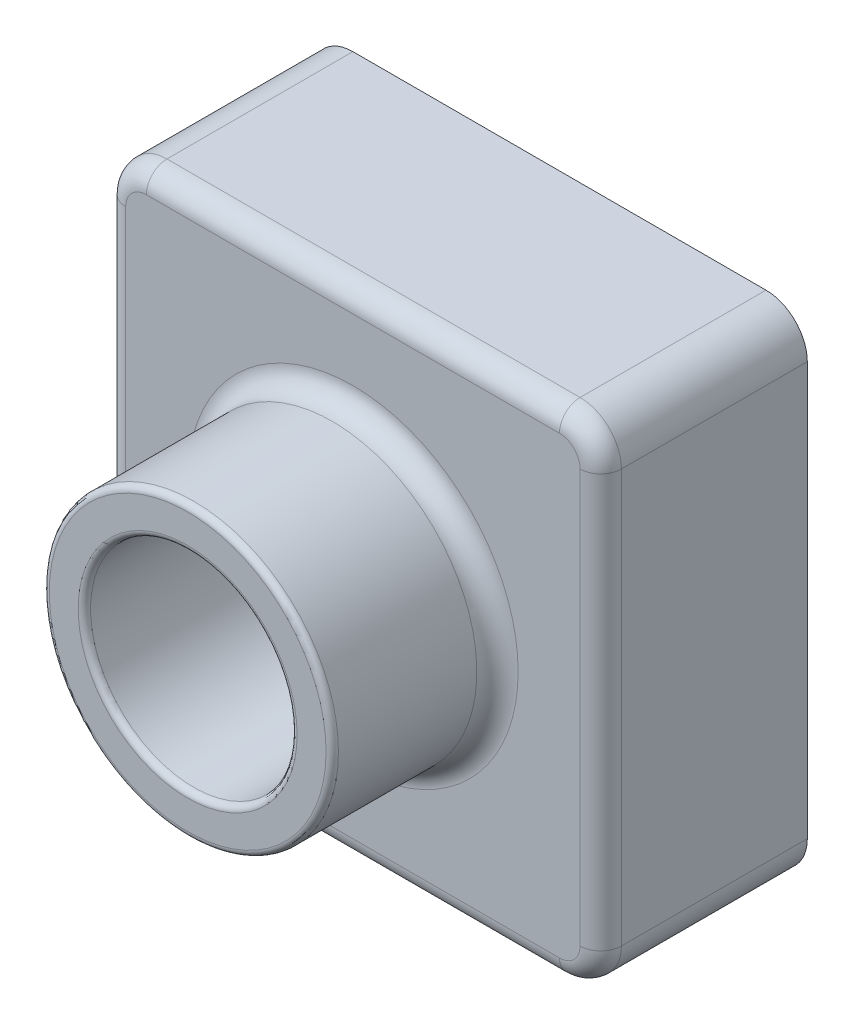
from build123d import *

# Parameters (mm, degrees)
SKETCH1_W           = 120
SKETCH1_H           = 120
BOSS_EXTRUDE1_DEPTH = 50
SKETCH3_R           = 35
BOSS_EXTRUDE2_DEPTH = 40
SKETCH4_R           = 25
CUT_EXTRUDE1_DEPTH  = 193.093727123
FILLET1_R           = 10
FILLET2_R           = 1.5
FILLET5_R           = 5
SHELL1_T            = -2


with BuildPart() as part:
    # Sketch1 → Boss-Extrude1 (new body)
    with BuildSketch(Plane.XY):
        with Locations((60, 60)):
            Rectangle(SKETCH1_W, SKETCH1_H)
    extrude(amount=BOSS_EXTRUDE1_DEPTH)

    # Sketch3 → Boss-Extrude2 (add)
    with BuildSketch(Plane.XY.offset(50)):
        with Locations((60, 60)):
            Circle(SKETCH3_R)
    extrude(amount=BOSS_EXTRUDE2_DEPTH)

    # Sketch4 → Cut-Extrude1 (cut, through all)
    with BuildSketch(Plane.XY.offset(90)):
        with Locations((60, 60)):
            Circle(SKETCH4_R)
    extrude(amount=-CUT_EXTRUDE1_DEPTH, mode=Mode.SUBTRACT)

    # Fillet1
    fillet1_edges = [part.edges().sort_by_distance(p)[0] for p in [
        (0, 0, 25),
        (0, 120, 25),
        (120, 0, 25),
        (120, 120, 25),
    ]]
    fillet(fillet1_edges, radius=FILLET1_R)

    # Fillet2
    fillet2_edges = [part.edges().sort_by_distance(p)[0] for p in [
        (25, 60, 90),
        (35, 60, 90),
    ]]
    fillet(fillet2_edges, radius=FILLET2_R)

    # Fillet5
    fillet5_edges = [part.edges().sort_by_distance(p)[0] for p in [
        (117.071067812, 2.928932188, 50),
        (60, 0, 50),
        (2.928932188, 2.928932188, 50),
        (0, 60, 50),
        (2.928932188, 117.071067812, 50),
        (60, 120, 50),
        (117.071067812, 117.071067812, 50),
        (120, 60, 50),
        (25, 60, 50),
    ]]
    fillet(fillet5_edges, radius=FILLET5_R)

    # Shell1
    shell1_openings = [part.faces().sort_by_distance(p)[0] for p in [
        (60, 1.697056275, 0),
    ]]
    offset(amount=SHELL1_T, openings=shell1_openings, kind=Kind.INTERSECTION)


solid = part.part
